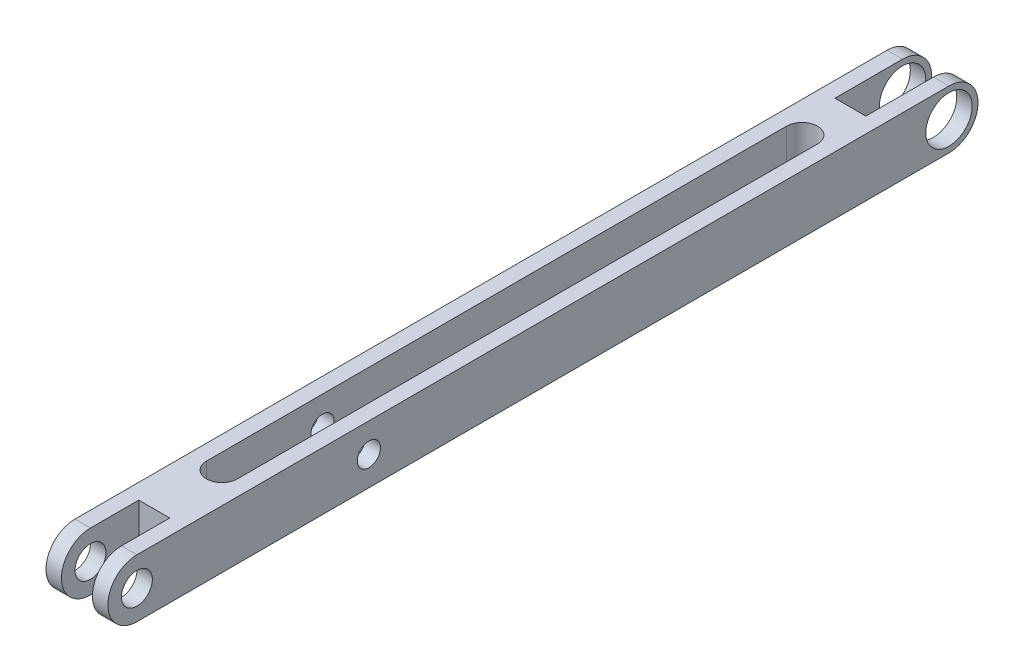
from build123d import *

# Parameters (mm, degrees)
EXTRUDE_1_DEPTH     = 16
SKETCH_3_W          = 8
SKETCH_3_H          = 20
SKETCH_3_H_2        = 25
CUT_EXTRUDE_1_DEPTH = 115.617843288
SKETCH_4_R          = 4
SKETCH_4_R_2        = 6
CUT_EXTRUDE_2_DEPTH = 114.879322091
CUT_EXTRUDE_3_DEPTH = 115.617843288
SKETCH_6_R          = 3
CUT_EXTRUDE_4_DEPTH = 114.879322091


with BuildPart() as part:
    # 草图2 → 凸台-拉伸1 (new body)
    with BuildSketch(Plane(origin=(0, 0, 0), x_dir=(0, 0, -1), z_dir=(1, 0, 0))):
        with BuildLine():
            Line((-105, -7.5), (105, -7.5))
            ThreePointArc((105, -7.5), (112.5, 0), (105, 7.5))
            Line((105, 7.5), (-105, 7.5))
            ThreePointArc((-105, 7.5), (-112.5, 0), (-105, -7.5))
        make_face()
    extrude(amount=EXTRUDE_1_DEPTH)

    # 草图3 → 切除-拉伸1 (cut, through all)
    with BuildSketch(Plane(origin=(0, 7.5, 0), x_dir=(1, 0, 0), z_dir=(0, 1, 0))):
        with Locations((8, -102.5)):
            Rectangle(SKETCH_3_W, SKETCH_3_H)
        with Locations((8, 100)):
            Rectangle(SKETCH_3_W, SKETCH_3_H_2)
    extrude(amount=-CUT_EXTRUDE_1_DEPTH, mode=Mode.SUBTRACT)

    # 草图4 → 切除-拉伸2 (cut, through all)
    with BuildSketch(Plane(origin=(16, 0, 0), x_dir=(0, 0, -1), z_dir=(1, 0, 0))):
        with Locations((-105, 0)):
            Circle(SKETCH_4_R)
        with Locations((105, 0)):
            Circle(SKETCH_4_R_2)
    extrude(amount=-CUT_EXTRUDE_2_DEPTH, mode=Mode.SUBTRACT)

    # 草图5 → 切除-拉伸3 (cut, through all)
    with BuildSketch(Plane.XZ.offset(7.5)):
        with BuildLine():
            Line((12, 75), (12, -75))
            ThreePointArc((12, -75), (8, -79), (4, -75))
            Line((4, -75), (4, 75))
            ThreePointArc((4, 75), (8, 79), (12, 75))
        make_face()
    extrude(amount=-CUT_EXTRUDE_3_DEPTH, mode=Mode.SUBTRACT)

    # 草图6 → 切除-拉伸4 (cut, through all)
    with BuildSketch(Plane.ZY):
        with Locations((45, 0)):
            Circle(SKETCH_6_R)
    extrude(amount=-CUT_EXTRUDE_4_DEPTH, mode=Mode.SUBTRACT)


solid = part.part
